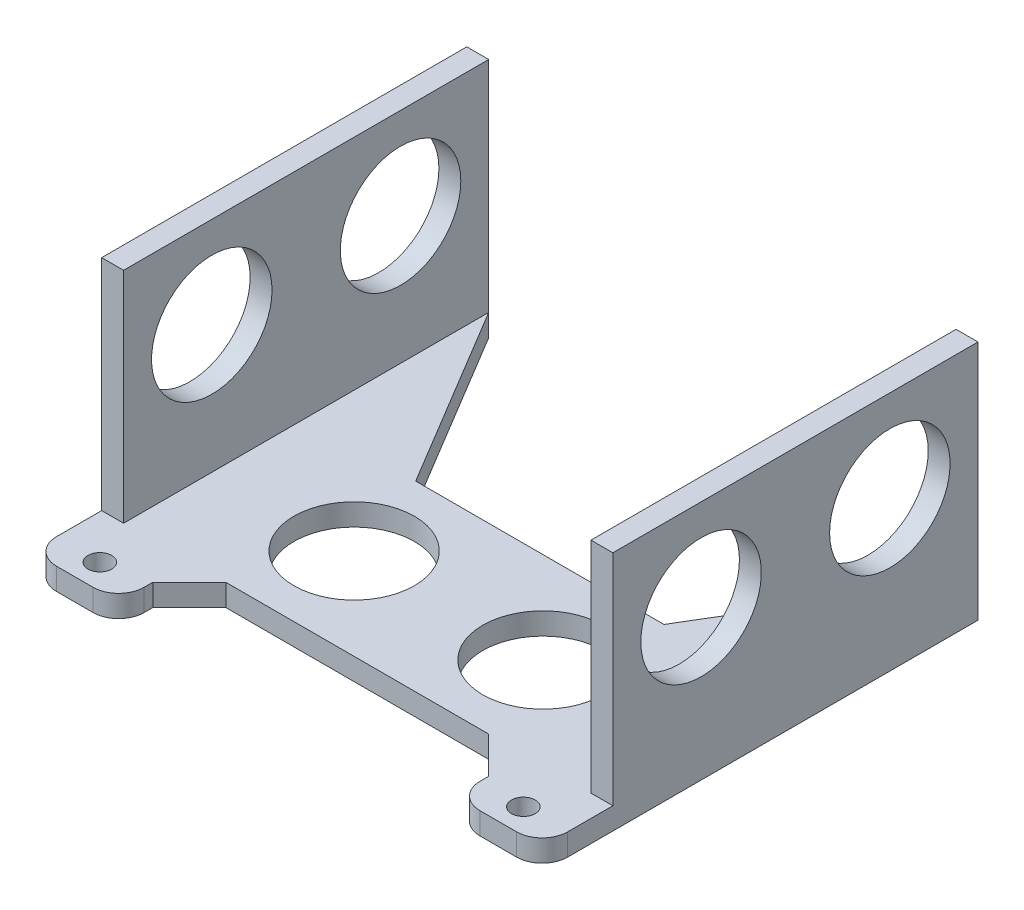
from build123d import *

# Parameters (mm, degrees)
CROQUIS1_W                 = 70
CROQUIS1_H                 = 62
SALIENTE_EXTRUIR1_DEPTH    = 3
CORTAR_EXTRUIR1_DEPTH      = 47.8508271
CORTAR_EXTRUIR2_DEPTH      = 47.8508271
CROQUIS4_W                 = 46
CROQUIS4_H                 = 10
CORTAR_EXTRUIR3_DEPTH      = 47.8508271
CROQUIS5_W                 = 46
CROQUIS5_H                 = 2
CORTAR_EXTRUIR4_DEPTH      = 47.8508271
CORTAR_EXTRUIR5_DEPTH      = 47.8508271
CORTAR_EXTRUIR5_DEPTH_BACK = 47.8508271
CROQUIS6_R                 = 1.625
CHAFL_N1_START             = -4
CHAFL_N1_OUTLINE_W         = 7.071067812
CHAFL_N1_OUTLINE_H         = 3
CHAFL_N1_DEPTH             = 4.707106781
CHAFL_N2_START             = -0.707106781
CHAFL_N2_OUTLINE_W         = 7.071067812
CHAFL_N2_OUTLINE_H         = 3
CHAFL_N2_DEPTH             = 4.707106781
CORTAR_EXTRUIR6_DEPTH      = 47.8508271
CORTAR_EXTRUIR6_DEPTH_BACK = 47.8508271
CROQUIS7_R                 = 8.25
SALIENTE_EXTRUIR2_DEPTH    = 3
CORTAR_EXTRUIR7_DEPTH      = 69.23672032
CORTAR_EXTRUIR7_DEPTH_BACK = 69.23672032
CORTAR_EXTRUIR8_DEPTH      = 47.8508271
CHAFL_N3_DEPTH             = 3
CHAFL_N5_DEPTH             = 3
CROQUIS13_W                = 50
CROQUIS13_H                = 30
SALIENTE_EXTRUIR3_DEPTH    = 3
CROQUIS14_W                = 50
CROQUIS14_H                = 30
SALIENTE_EXTRUIR4_DEPTH    = 3
REDONDEO1_R                = 5
CORTAR_EXTRUIR9_DEPTH      = 84.366660003
CORTAR_EXTRUIR9_DEPTH_BACK = 84.366660003
CROQUIS16_R                = 8.25
CROQUIS17_W                = 10.440463992
CROQUIS17_H                = 4.63729848
CORTAR_EXTRUIR10_DEPTH     = 5
CROQUIS18_W                = 0.779768004
CROQUIS18_H                = 2.68135076
SALIENTE_EXTRUIR5_DEPTH    = 3
CROQUIS19_W                = 0.779768004
CROQUIS19_H                = 2.68135076
SALIENTE_EXTRUIR6_DEPTH    = 3
REDONDEO6_R                = 3.5
REDONDEO7_R                = 3.5


with BuildPart() as part:
    # Croquis1 → Saliente-Extruir1 (new body)
    with BuildSketch(Plane(origin=(0, 0, 0), x_dir=(1, 0, 0), z_dir=(0, 1, 0))):
        Rectangle(CROQUIS1_W, CROQUIS1_H)
    extrude(amount=SALIENTE_EXTRUIR1_DEPTH)

    # Croquis2 → Cortar-Extruir1 (cut, through all)
    with BuildSketch(Plane(origin=(0, 3, 0), x_dir=(1, 0, 0), z_dir=(0, 1, 0))):
        Polygon((31.754264805, 31), (15.877132403, 58.5), (-15.877132403, 58.5), (-31.754264805, 31), (-15.877132403, 3.5), (15.877132403, 3.5), align=None)
    extrude(amount=-CORTAR_EXTRUIR1_DEPTH, mode=Mode.SUBTRACT)

    # Croquis3 → Cortar-Extruir2 (cut, through all)
    with BuildSketch(Plane(origin=(0, 3, 0), x_dir=(1, 0, 0), z_dir=(0, 1, 0))):
        with BuildLine():
            Line((-13, -21), (13, -21))
            ThreePointArc((13, -21), (23, -31), (13, -41))
            Line((13, -41), (-13, -41))
            ThreePointArc((-13, -41), (-23, -31), (-13, -21))
        make_face()
    extrude(amount=-CORTAR_EXTRUIR2_DEPTH, mode=Mode.SUBTRACT)

    # Croquis4 → Cortar-Extruir3 (cut, through all)
    with BuildSketch(Plane(origin=(0, 3, 0), x_dir=(1, 0, 0), z_dir=(0, 1, 0))):
        with Locations((0, -26)):
            Rectangle(CROQUIS4_W, CROQUIS4_H)
    extrude(amount=-CORTAR_EXTRUIR3_DEPTH, mode=Mode.SUBTRACT)

    # Croquis5 → Cortar-Extruir4 (cut, through all)
    with BuildSketch(Plane(origin=(0, 3, 0), x_dir=(1, 0, 0), z_dir=(0, 1, 0))):
        with Locations((0, -20)):
            Rectangle(CROQUIS5_W, CROQUIS5_H)
    extrude(amount=-CORTAR_EXTRUIR4_DEPTH, mode=Mode.SUBTRACT)

    # Croquis6 → Cortar-Extruir5 (cut, two sides: drawn at the far end of the back side and taken through both)
    with BuildSketch(Plane(origin=(0, 3, 0), x_dir=(1, 0, 0), z_dir=(0, 1, 0)).offset(-CORTAR_EXTRUIR5_DEPTH_BACK)):
        with Locations(Location((-29, -25.25, 0), (0, 0, 270))):
            Circle(CROQUIS6_R)
        with Locations(Location((29, -25.25, 0), (0, 0, 270))):
            Circle(CROQUIS6_R)
    extrude(amount=CORTAR_EXTRUIR5_DEPTH + CORTAR_EXTRUIR5_DEPTH_BACK, mode=Mode.SUBTRACT)

    # Chaflán1: read off the stored shape, not the designer's step
    # Chaflán1 outline → Chaflán1 (add)
    with BuildSketch(Plane(origin=(0, 0, 0), x_dir=(0.7071067811865471, 0, -0.707106781186548), z_dir=(0.707106781186548, 0, 0.707106781186547)).offset(CHAFL_N1_START)):
        with Locations((-29.69848481, 1.5)):
            Rectangle(CHAFL_N1_OUTLINE_W, CHAFL_N1_OUTLINE_H)
    extrude(amount=CHAFL_N1_DEPTH)

    # Chaflán2: read off the stored shape, not the designer's step
    # Chaflán2 outline → Chaflán2 (add)
    with BuildSketch(Plane(origin=(0, 0, 0), x_dir=(0.707106781186548, 0, 0.707106781186547), z_dir=(0.707106781186547, 0, -0.707106781186548)).offset(CHAFL_N2_START)):
        with Locations((29.69848481, -1.5)):
            Rectangle(CHAFL_N2_OUTLINE_W, CHAFL_N2_OUTLINE_H)
    extrude(amount=CHAFL_N2_DEPTH)

    # Croquis7 → Cortar-Extruir6 (cut, two sides: drawn at the far end of the back side and taken through both)
    with BuildSketch(Plane(origin=(0, 3, 0), x_dir=(1, 0, 0), z_dir=(0, 1, 0)).offset(-CORTAR_EXTRUIR6_DEPTH_BACK)):
        with Locations(Location((-12.93, -6.5, 0), (0, 0, 270))):
            Circle(CROQUIS7_R)
        with Locations(Location((12.93, -6.5, 0), (0, 0, 270))):
            Circle(CROQUIS7_R)
    extrude(amount=CORTAR_EXTRUIR6_DEPTH + CORTAR_EXTRUIR6_DEPTH_BACK, mode=Mode.SUBTRACT)

    # Croquis8 → Saliente-Extruir2 (add)
    with BuildSketch(Plane(origin=(0, 3, 0), x_dir=(1, 0, 0), z_dir=(0, 1, 0))):
        Polygon((15.877132403, 3.5), (31.754264805, 31), (15.877132403, 58.5), (-15.877132403, 58.5), (-31.754264805, 31), (-15.877132403, 3.5), (0, 3.5), align=None)
    extrude(amount=-SALIENTE_EXTRUIR2_DEPTH)

    # Croquis9 → Cortar-Extruir7 (cut, two sides: drawn at the far end of the back side and taken through both)
    with BuildSketch(Plane(origin=(0, 3, 0), x_dir=(1, 0, 0), z_dir=(0, 1, 0)).offset(-CORTAR_EXTRUIR7_DEPTH_BACK)):
        Polygon((-232.018715641, 31), (-35, 31), (35, 31), (232.018715641, 31), (232.018715641, 425.037431282), (-232.018715641, 425.037431282), align=None)
    extrude(amount=CORTAR_EXTRUIR7_DEPTH + CORTAR_EXTRUIR7_DEPTH_BACK, mode=Mode.SUBTRACT)

    # Croquis10 → Cortar-Extruir8 (cut, through all)
    with BuildSketch(Plane(origin=(0, 3, 0), x_dir=(1, 0, 0), z_dir=(0, 1, 0))):
        Polygon((0, 6), (-32, 6), (-32, 31), (32, 31), (32, 6), align=None)
    extrude(amount=-CORTAR_EXTRUIR8_DEPTH, mode=Mode.SUBTRACT)

    # Chaflán3: read off the stored shape, not the designer's step
    # Chaflán3 outline → Chaflán3 (add)
    with BuildSketch(Plane(origin=(0, 0, 0), x_dir=(1, 0, 0), z_dir=(0, 1, 0))):
        Polygon((-32, 6), (-17, 6), (-32, 31), align=None)
    extrude(amount=CHAFL_N3_DEPTH)

    # Chaflán5: read off the stored shape, not the designer's step
    # Chaflán5 outline → Chaflán5 (add)
    with BuildSketch(Plane(origin=(0, 0, 0), x_dir=(1, 0, 0), z_dir=(0, 1, 0))):
        Polygon((32, 6), (32, 31), (17, 6), align=None)
    extrude(amount=CHAFL_N5_DEPTH)

    # Croquis13 → Saliente-Extruir3 (add)
    with BuildSketch(Plane.ZY.offset(35)):
        with Locations((-6, 18)):
            Rectangle(CROQUIS13_W, CROQUIS13_H)
    extrude(amount=-SALIENTE_EXTRUIR3_DEPTH)

    # Croquis14 → Saliente-Extruir4 (add)
    with BuildSketch(Plane(origin=(35, 0, 0), x_dir=(0, 0, -1), z_dir=(1, 0, 0))):
        with Locations((6, 18)):
            Rectangle(CROQUIS14_W, CROQUIS14_H)
    extrude(amount=-SALIENTE_EXTRUIR4_DEPTH)

    # Redondeo1
    redondeo1_edges = [part.edges().sort_by_distance(p)[0] for p in [
        (-23, 1.5, 31),
        (23, 1.5, 31),
        (35, 1.5, 31),
        (-35, 1.5, 31),
    ]]
    fillet(redondeo1_edges, radius=REDONDEO1_R)

    # Croquis16 → Cortar-Extruir9 (cut, two sides: drawn at the far end of the back side and taken through both)
    with BuildSketch(Plane.ZY.offset(35).offset(-CORTAR_EXTRUIR9_DEPTH_BACK)):
        with Locations((-18.93, 20.5)):
            Circle(CROQUIS16_R)
        with Locations((6.92, 20.5)):
            Circle(CROQUIS16_R)
    extrude(amount=CORTAR_EXTRUIR9_DEPTH + CORTAR_EXTRUIR9_DEPTH_BACK, mode=Mode.SUBTRACT)

    # Croquis17 → Cortar-Extruir10 (cut)
    with BuildSketch(Plane(origin=(0, 3, 0), x_dir=(1, 0, 0), z_dir=(0, 1, 0))):
        with Locations((-29, -31)):
            Rectangle(CROQUIS17_W, CROQUIS17_H)
        with Locations((29, -31)):
            Rectangle(CROQUIS17_W, CROQUIS17_H)
    extrude(amount=-CORTAR_EXTRUIR10_DEPTH, mode=Mode.SUBTRACT)

    # Croquis18 → Saliente-Extruir5 (add)
    with BuildSketch(Plane(origin=(0, 3, 0), x_dir=(1, 0, 0), z_dir=(0, 1, 0))):
        with Locations((-34.610115998, -27.34067538)):
            Rectangle(CROQUIS18_W, CROQUIS18_H)
        with Locations((-23.389884002, -27.34067538)):
            Rectangle(CROQUIS18_W, CROQUIS18_H)
    extrude(amount=-SALIENTE_EXTRUIR5_DEPTH)

    # Croquis19 → Saliente-Extruir6 (add)
    with BuildSketch(Plane(origin=(0, 3, 0), x_dir=(1, 0, 0), z_dir=(0, 1, 0))):
        with Locations((23.389884002, -27.34067538)):
            Rectangle(CROQUIS19_W, CROQUIS19_H)
        with Locations((34.610115998, -27.34067538)):
            Rectangle(CROQUIS19_W, CROQUIS19_H)
    extrude(amount=-SALIENTE_EXTRUIR6_DEPTH)

    # Redondeo6
    redondeo6_edges = [part.edges().sort_by_distance(p)[0] for p in [
        (-35, 1.5, 28.68135076),
    ]]
    fillet(redondeo6_edges, radius=REDONDEO6_R)

    # Redondeo7
    redondeo7_edges = [part.edges().sort_by_distance(p)[0] for p in [
        (-23, 1.5, 28.68135076),
        (23, 1.5, 28.68135076),
        (35, 1.5, 28.68135076),
    ]]
    fillet(redondeo7_edges, radius=REDONDEO7_R)


solid = part.part
